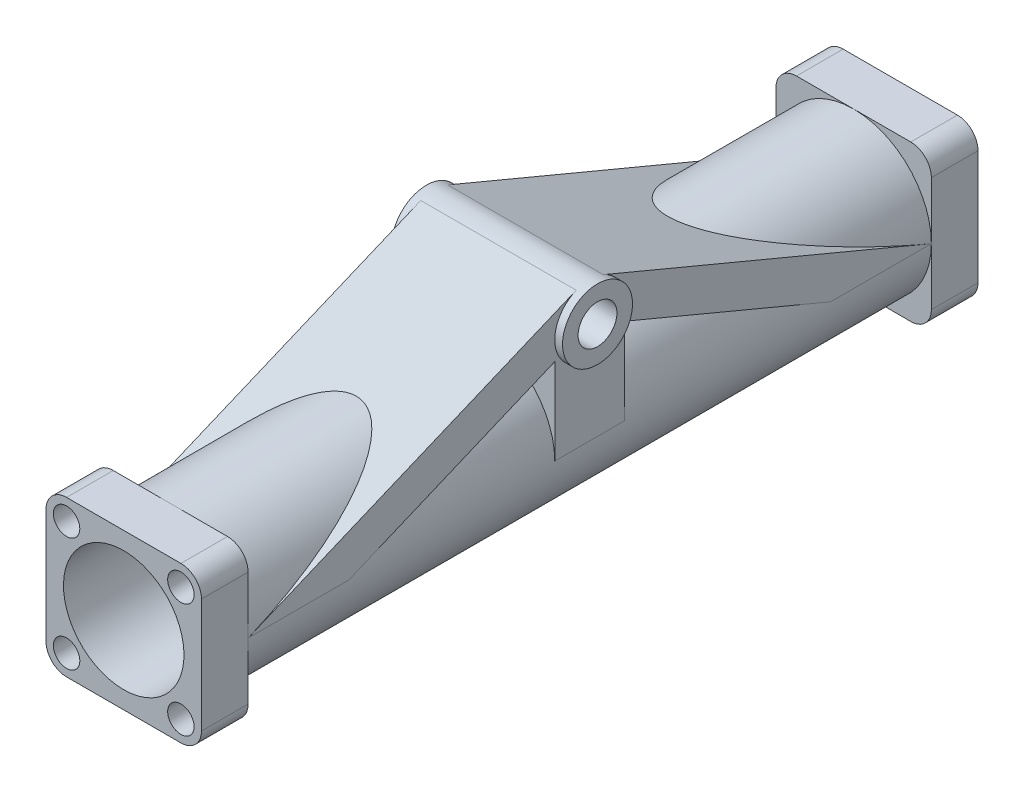
from build123d import *
from build123d.topology import SkipClean

# Parameters (mm, degrees)
SKIZZE2_W                            = 99.9
SKIZZE2_H                            = 2.25
SKIZZE3_W                            = 20
SKIZZE3_H                            = 20
SKIZZE3_R                            = 7.75
AUFSATZ_LINEAR_AUSTRAGEN1_DEPTH      = 6
SKIZZE5_R                            = 1.7
SCHNITT_LINEAR_AUSTRAGEN1_DEPTH      = 4
SCHNITT_LINEAR_AUSTRAGEN2_DEPTH      = 101.896035601
SCHNITT_LINEAR_AUSTRAGEN4_DEPTH      = 3
SCHNITT_LINEAR_AUSTRAGEN4_DEPTH_BACK = 101.896035601
SKIZZE8_W                            = 20
SKIZZE8_H                            = 15.917157288
AUFSATZ_LINEAR_AUSTRAGEN2_REACH      = 61.61
AUFSATZ_LINEAR_AUSTRAGEN11_DEPTH     = 20
SKIZZE20_R                           = 7.75
SCHNITT_LINEAR_AUSTRAGEN7_DEPTH      = 103.000049029
AUFSATZ_LINEAR_START                 = -21
SKIZZE21_R                           = 4.5
AUFSATZ_LINEAR_AUSTRAGEN12_DEPTH     = 22
SKIZZE22_R                           = 2.5
SCHNITT_LINEAR_AUSTRAGEN8_DEPTH      = 104.86534552
AUFSATZ_LINEAR_START_2               = -9.539392014
AUFSATZ_LINEAR_AUSTRAGEN14_DEPTH     = 2.39358905
AUFSATZ_LINEAR_START_3               = -20.918031139
AUFSATZ_LINEAR_AUSTRAGEN15_OUTLINE_W = 4.519922446
AUFSATZ_LINEAR_AUSTRAGEN15_OUTLINE_H = 9
AUFSATZ_LINEAR_AUSTRAGEN15_DEPTH     = 16.398108693
AUFSATZ_LINEAR_START_4               = 5.480077554
AUFSATZ_LINEAR_AUSTRAGEN15_2_DEPTH   = 4.519922446
AUFSATZ_LINEAR_START_5               = -54.45
AUFSATZ_LINEAR_AUSTRAGEN15_3_DEPTH   = 9
SKIZZE26_R                           = 7.75
SCHNITT_LINEAR_AUSTRAGEN9_DEPTH      = 9


with BuildPart() as part:
    # Skizze2 → Rotation1 (revolve)
    with BuildSketch(Plane(origin=(0, 0, 0), x_dir=(0, 0, -1), z_dir=(1, 0, 0)), mode=Mode.PRIVATE) as rotation1_sk:
        with Locations((49.95, 8.875)):
            Rectangle(SKIZZE2_W, SKIZZE2_H)
    revolve(rotation1_sk.sketch.rotate(Axis((0, 0, -49.15), (0, 0, -1)), 180), axis=Axis((0, 0, -49.15), (0, 0, -1)))

    # Skizze3 → Aufsatz-Linear austragen1 (add)
    with BuildSketch(Plane.XY):
        Rectangle(SKIZZE3_W, SKIZZE3_H)
        with Locations(Location((0, 0, 0), (0, 0, 270))):
            Circle(SKIZZE3_R, mode=Mode.SUBTRACT)
    aufsatz_linear_austragen1 = extrude(amount=-AUFSATZ_LINEAR_AUSTRAGEN1_DEPTH)

    # Skizze5 → Schnitt-Linear austragen1 (cut)
    with BuildSketch(Plane.XY):
        with Locations((-7.352290732, 7.352290732)):
            Circle(SKIZZE5_R)
        with Locations(Location((-7.352290732, -7.352290732, 0), (0, 0, 180))):
            Circle(SKIZZE5_R)
        with Locations((7.352290732, -7.352290732)):
            Circle(SKIZZE5_R)
        with Locations(Location((7.352290732, 7.352290732, 0), (0, 0, 180))):
            Circle(SKIZZE5_R)
    schnitt_linear_austragen1 = extrude(amount=-SCHNITT_LINEAR_AUSTRAGEN1_DEPTH, mode=Mode.SUBTRACT)

    # Spiegeln1: Aufsatz-Linear austragen1, Schnitt-Linear austragen1 across plane
    add(aufsatz_linear_austragen1.mirror(Plane.XY.offset(-49.95)))
    add(schnitt_linear_austragen1.mirror(Plane.XY.offset(-49.95)), mode=Mode.SUBTRACT)

    # Skizze6 → Schnitt-Linear austragen2 (cut, through all)
    with BuildSketch(Plane.XY):
        with BuildLine():
            Line((-10, 7.352290732), (-10.707106781, 7.352290732))
            Line((-10.707106781, 7.352290732), (-10.707106781, 10.707106781))
            Line((-10.707106781, 10.707106781), (-7.352290732, 10.707106781))
            Line((-7.352290732, 10.707106781), (-7.352290732, 10))
            ThreePointArc((-7.352290732, 10), (-9.22450391, 9.22450391), (-10, 7.352290732))
        make_face()
        with BuildLine():
            Line((7.352290732, 10.707106781), (7.352290732, 10))
            ThreePointArc((7.352290732, 10), (9.22450391, 9.22450391), (10, 7.352290732))
            Line((10, 7.352290732), (10.707106781, 7.352290732))
            Line((10.707106781, 7.352290732), (10.707106781, 10.707106781))
            Line((10.707106781, 10.707106781), (7.352290732, 10.707106781))
        make_face()
        with BuildLine():
            Line((10, -7.352290732), (10.707106781, -7.352290732))
            Line((10.707106781, -7.352290732), (10.707106781, -10.707106781))
            Line((10.707106781, -10.707106781), (7.352290732, -10.707106781))
            Line((7.352290732, -10.707106781), (7.352290732, -10))
            ThreePointArc((7.352290732, -10), (9.22450391, -9.22450391), (10, -7.352290732))
        make_face()
        with BuildLine():
            Line((-7.352290732, -10.707106781), (-7.352290732, -10))
            ThreePointArc((-7.352290732, -10), (-9.22450391, -9.22450391), (-10, -7.352290732))
            Line((-10, -7.352290732), (-10.707106781, -7.352290732))
            Line((-10.707106781, -7.352290732), (-10.707106781, -10.707106781))
            Line((-10.707106781, -10.707106781), (-7.352290732, -10.707106781))
        make_face()
    extrude(amount=-SCHNITT_LINEAR_AUSTRAGEN2_DEPTH, mode=Mode.SUBTRACT)

    # Skizze8 → Schnitt-Linear austragen4 (cut, two sides: drawn at the far end of the back side and taken through both)
    with BuildSketch(Plane(origin=(0, 0, 0), x_dir=(1, 0, 0), z_dir=(0, 1, 0)).offset(-SCHNITT_LINEAR_AUSTRAGEN4_DEPTH_BACK)):
        with Locations((0, 49.95)):
            Rectangle(SKIZZE8_W, SKIZZE8_H)
    extrude(amount=SCHNITT_LINEAR_AUSTRAGEN4_DEPTH + SCHNITT_LINEAR_AUSTRAGEN4_DEPTH_BACK, mode=Mode.SUBTRACT)

    # Skizze9 → Aufsatz-Linear austragen2 (add, up to next)
    with BuildSketch(Plane(origin=(0, 0, -41.991421356), x_dir=(-1, 0, 0), z_dir=(0, 0, -1)), mode=Mode.PRIVATE) as aufsatz_linear_austragen2_sk1:
        with BuildLine():
            Line((-9.539392014, 3), (-7.145802964, 3))
            ThreePointArc((-7.145802964, 3), (-7.604679056, -1.493772558), (-5.480077554, -5.480077554))
            Line((-5.480077554, -5.480077554), (-7.071067812, -7.071067812))
            ThreePointArc((-7.071067812, -7.071067812), (-9.712540637, -2.380452557), (-9.539392014, 3))
        make_face()
    aufsatz_linear_austragen2_tool1 = extrude(aufsatz_linear_austragen2_sk1.sketch, amount=AUFSATZ_LINEAR_AUSTRAGEN2_REACH, mode=Mode.PRIVATE) - part.part
    add(aufsatz_linear_austragen2_tool1.solids().sort_by_distance((8.235697, -1.849559, -41.991421))[0])

    # Skizze19 → Aufsatz-Linear austragen11 (add, through all)
    with BuildSketch(Plane.ZY.offset(10)):
        with BuildLine():
            Line((-51.686004996, 17.65166071), (-93.9, 0))
            Line((-93.9, 0), (-80.939207809, 0))
            Line((-80.939207809, 0), (-53.883064142, 11.31344873))
            ThreePointArc((-53.883064142, 11.31344873), (-49.95, 9), (-46.016935858, 11.31344873))
            Line((-46.016935858, 11.31344873), (-18.960792191, 0))
            Line((-18.960792191, 0), (-6, 0))
            Line((-6, 0), (-48.213995004, 17.65166071))
            ThreePointArc((-48.213995004, 17.65166071), (-49.95, 18), (-51.686004996, 17.65166071))
        make_face()
    extrude(amount=-AUFSATZ_LINEAR_AUSTRAGEN11_DEPTH)

    # Skizze20 → Schnitt-Linear austragen7 (cut, through all)
    with SkipClean():  # the faces are left unmerged after this step: merging them gives an invalid solid
        with BuildSketch(Plane(origin=(0, 0, -99.9), x_dir=(-1, 0, 0), z_dir=(0, 0, -1))):
            with Locations(Location((0, 0, 0), (0, 0, 270))):
                Circle(SKIZZE20_R)
        extrude(amount=-SCHNITT_LINEAR_AUSTRAGEN7_DEPTH, mode=Mode.SUBTRACT)

    # Skizze21 → Aufsatz-Linear austragen12 (add)
    with SkipClean():  # the faces are left unmerged after this step: merging them gives an invalid solid
        with BuildSketch(Plane.ZY.offset(10).offset(AUFSATZ_LINEAR_START)):
            with Locations((-49.95, 13.5)):
                Circle(SKIZZE21_R)
        extrude(amount=AUFSATZ_LINEAR_AUSTRAGEN12_DEPTH)

    # Skizze22 → Schnitt-Linear austragen8 (cut, through all)
    with SkipClean():  # the faces are left unmerged after this step: merging them gives an invalid solid
        with BuildSketch(Plane(origin=(11, 0, 0), x_dir=(0, 0, -1), z_dir=(1, 0, 0))):
            with Locations((49.95, 13.5)):
                Circle(SKIZZE22_R)
        extrude(amount=-SCHNITT_LINEAR_AUSTRAGEN8_DEPTH, mode=Mode.SUBTRACT)

    # Aufsatz-Linear austragen14: read off the stored shape, not the designer's step
    # Aufsatz-Linear austragen14 outline → Aufsatz-Linear austragen14 (add)
    with SkipClean():  # the faces are left unmerged after this step: merging them gives an invalid solid
        with BuildSketch(Plane.YZ.offset(AUFSATZ_LINEAR_START_2)):
            with BuildLine():
                Line((11.31344873, -46.016935858), (11.076386129, -45.45))
                Line((11.076386129, -45.45), (3, -45.45))
                Line((3, -45.45), (3, -54.45))
                Line((3, -54.45), (11.076386129, -54.45))
                Line((11.076386129, -54.45), (11.31344873, -53.883064142))
                ThreePointArc((11.31344873, -53.883064142), (9, -49.95), (11.31344873, -46.016935858))
            make_face()
        extrude(amount=AUFSATZ_LINEAR_AUSTRAGEN14_DEPTH)

    # Aufsatz-Linear austragen15: read off the stored shape, not the designer's step
    # Aufsatz-Linear austragen15 outline → Aufsatz-Linear austragen15 (add)
    with SkipClean():  # the faces are left unmerged after this step: merging them gives an invalid solid
        with BuildSketch(Plane(origin=(0, -10, 0), x_dir=(-1, 0, 0), z_dir=(0, -1, 0)).offset(AUFSATZ_LINEAR_START_3)):
            with Locations((-7.740038777, 49.95)):
                Rectangle(AUFSATZ_LINEAR_AUSTRAGEN15_OUTLINE_W, AUFSATZ_LINEAR_AUSTRAGEN15_OUTLINE_H)
        extrude(amount=AUFSATZ_LINEAR_AUSTRAGEN15_DEPTH)

    # Aufsatz-Linear austragen15 2 outline → Aufsatz-Linear austragen15 2 (add)
    with SkipClean():  # the faces are left unmerged after this step: merging them gives an invalid solid
        with BuildSketch(Plane.YZ.offset(AUFSATZ_LINEAR_START_4)):
            with BuildLine():
                Line((11.076386129, -45.45), (10.918031139, -45.45))
                Line((10.918031139, -45.45), (10.918031139, -46.264428565))
                ThreePointArc((10.918031139, -46.264428565), (11.112530792, -46.135554984), (11.31344873, -46.016935858))
                Line((11.31344873, -46.016935858), (11.076386129, -45.45))
            make_face()
            with BuildLine():
                Line((10.918031139, -53.635571435), (10.918031139, -54.45))
                Line((10.918031139, -54.45), (11.076386129, -54.45))
                Line((11.076386129, -54.45), (11.31344873, -53.883064142))
                ThreePointArc((11.31344873, -53.883064142), (11.112530792, -53.764445016), (10.918031139, -53.635571435))
            make_face()
        extrude(amount=AUFSATZ_LINEAR_AUSTRAGEN15_2_DEPTH)

    # Aufsatz-Linear austragen15 3 outline → Aufsatz-Linear austragen15 3 (add)
    with SkipClean():  # the faces are left unmerged after this step: merging them gives an invalid solid
        with BuildSketch(Plane.XY.offset(AUFSATZ_LINEAR_START_5)):
            with BuildLine():
                Line((7.071067812, -7.071067812), (10, -10))
                Line((10, -10), (10, -5.480077554))
                Line((10, -5.480077554), (8.364732512, -5.480077554))
                ThreePointArc((8.364732512, -5.480077554), (7.75878827, -6.308819588), (7.071067812, -7.071067812))
            make_face()
        extrude(amount=AUFSATZ_LINEAR_AUSTRAGEN15_3_DEPTH)

    # Skizze26 → Schnitt-Linear austragen9 (cut)
    with BuildSketch(Plane.XY.offset(-45.45)):
        with Locations(Location((0, 0, 0), (0, 0, 270))):
            Circle(SKIZZE26_R)
        with BuildLine():
            Line((7.071067812, -7.071067812), (10, -10))
            Line((10, -10), (10, 0))
            ThreePointArc((10, 0), (9.238795325, -3.826834324), (7.071067812, -7.071067812))
        make_face()
    extrude(amount=-SCHNITT_LINEAR_AUSTRAGEN9_DEPTH, mode=Mode.SUBTRACT)


solid = part.part
